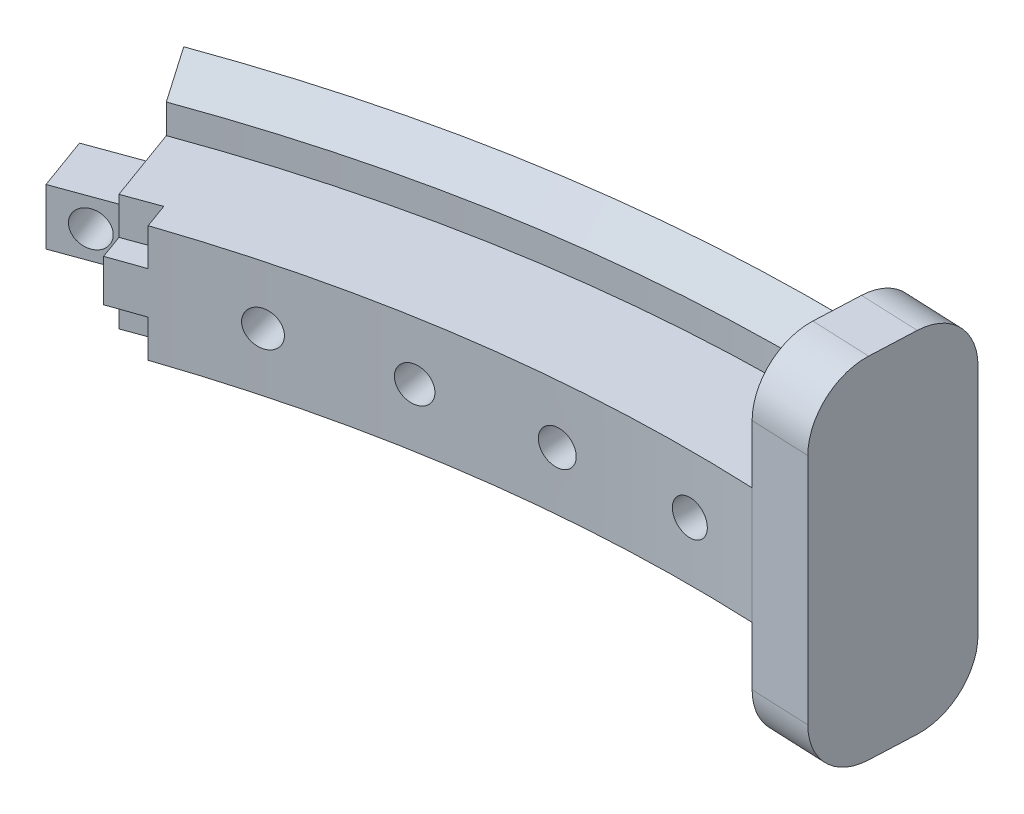
from build123d import *

# Parameters (mm, degrees)
REVOLVE_1_ANGLE          = 40
SKETCH_4_W               = 4.8
SKETCH_4_H               = 4.8
EXTRUDE_1_DEPTH          = 6
SKETCH_7_R               = 1.5
CUT_EXTRUDE_4_DEPTH      = 95.895882206
SKETCH_13_R              = 1.5
CUT_EXTRUDE_7_DEPTH      = 57.80711304
CUT_EXTRUDE_8_DEPTH      = 5
PATTERN_CIRCULAR_1_COUNT = 4
PATTERN_CIRCULAR_1_ANGLE = 15
SKETCH_10_W              = 2.2
SKETCH_10_H              = 5.2
CUT_EXTRUDE_5_DEPTH      = 3
SKETCH_11_W              = 47.375376564
SKETCH_11_H              = 32.407082742
CUT_EXTRUDE_6_DEPTH      = 149.607349927
SKETCH_12_W              = 14
SKETCH_12_H              = 30
EXTRUDE_2_DEPTH          = 5
FILLET_1_R               = 5


# Read off the part's stored shape, not the designer's step: 旋转1
with BuildPart() as part:
    # 旋转1 outline → 旋转1 (revolve)
    with BuildSketch(Plane(origin=(0, 0, 0), x_dir=(0.3420201433256701, 0, -0.9396926207859079), z_dir=(0.9396926207859079, 0, 0.3420201433256701))):
        Polygon((134, 5), (125, 5), (125, -5), (134, -5), (134, -7.5), (136.5, -10), (139, -7.5), (139, 7.5), (136.5, 10), (134, 7.5), align=None)
    revolve(axis=Axis((0, 0, 0), (0, 1, 0)), revolution_arc=REVOLVE_1_ANGLE)

    # 草图4 → 凸台-拉伸1 (add)
    with BuildSketch(Plane(origin=(0, 0, 0), x_dir=(0.3420201433256631, 0, 0.9396926207859104), z_dir=(-0.9396926207859104, 0, 0.3420201433256631))):
        with Locations((-132, 0)):
            Rectangle(SKETCH_4_W, SKETCH_4_H)
    extrude(amount=EXTRUDE_1_DEPTH)

    # 草图7 → 切除-拉伸4 (cut, through all)
    with BuildSketch(Plane(origin=(-45.967507263, 0, -126.294688234), x_dir=(-0.9396926207859105, 0, 0.3420201433256632), z_dir=(-0.3420201433256632, 0, -0.9396926207859105))):
        with Locations((3, 0)):
            Circle(SKETCH_7_R)
    extrude(amount=-CUT_EXTRUDE_4_DEPTH, mode=Mode.SUBTRACT)

    # 草图13 → 切除-拉伸7 (cut, through all)
    with BuildSketch(Plane(origin=(0, 0, -139), x_dir=(-1, 0, 0), z_dir=(0, 0, -1))):
        Circle(SKETCH_13_R)
    cut_extrude_7 = extrude(amount=-CUT_EXTRUDE_7_DEPTH, mode=Mode.SUBTRACT)

    # 草图14 → 切除-拉伸8 (cut)
    with BuildSketch(Plane(origin=(0, 0, -139), x_dir=(-1, 0, 0), z_dir=(0, 0, -1))):
        Polygon((0, -3.175426481), (2.75, -1.58771324), (2.75, 1.58771324), (0, 3.175426481), (-2.75, 1.58771324), (-2.75, -1.58771324), align=None)
    cut_extrude_8 = extrude(amount=-CUT_EXTRUDE_8_DEPTH, mode=Mode.SUBTRACT)

    # 阵列(圆周)1: 切除-拉伸7, 切除-拉伸8 ×4 about axis
    pattern_circular_1_axis = Axis((0, 0, 0), (0, 1, 0))
    add([cut_extrude_7.rotate(pattern_circular_1_axis, i * PATTERN_CIRCULAR_1_ANGLE / (PATTERN_CIRCULAR_1_COUNT - 1)) for i in range(1, PATTERN_CIRCULAR_1_COUNT)], mode=Mode.SUBTRACT)
    add([cut_extrude_8.rotate(pattern_circular_1_axis, i * PATTERN_CIRCULAR_1_ANGLE / (PATTERN_CIRCULAR_1_COUNT - 1)) for i in range(1, PATTERN_CIRCULAR_1_COUNT)], mode=Mode.SUBTRACT)

    # 草图10 → 切除-拉伸5 (cut)
    with BuildSketch(Plane(origin=(0, 0, 0), x_dir=(0.3420201433256631, 0, 0.9396926207859104), z_dir=(-0.9396926207859104, 0, 0.3420201433256631))):
        with Locations((-137.9, 0)):
            Rectangle(SKETCH_10_W, SKETCH_10_H)
        Polygon((-127.2, 5), (-125, 5), (-123.655375964, 5), (-123.655375964, 1.8), (-125, 1.8), (-127.2, 1.8), align=None)
        Polygon((-127.2, -1.8), (-125, -1.8), (-123.655375964, -1.8), (-123.655375964, -5), (-125, -5), (-127.2, -5), align=None)
    extrude(amount=-CUT_EXTRUDE_5_DEPTH, mode=Mode.SUBTRACT)

    # 草图11 → 切除-拉伸6 (cut, through all)
    with BuildSketch(Plane(origin=(0, 0, 0), x_dir=(0, -1, 0), z_dir=(0.9990482215818578, 0, 0.0436193873653361))):
        with Locations((-1.017262687, 125.577370773)):
            Rectangle(SKETCH_11_W, SKETCH_11_H)
    extrude(amount=CUT_EXTRUDE_6_DEPTH, mode=Mode.SUBTRACT)

    # 草图12 → 凸台-拉伸2 (add)
    with BuildSketch(Plane(origin=(0, 0, 0), x_dir=(0.043619387365336125, 0, -0.9990482215818578), z_dir=(0.9990482215818577, 0, 0.04361938736533612))):
        with Locations((132, 0)):
            Rectangle(SKETCH_12_W, SKETCH_12_H)
    extrude(amount=EXTRUDE_2_DEPTH)

    # 圆角1
    fillet_1_edges = [part.edges().sort_by_distance(p)[0] for p in [
        (7.950043975, 15, -124.771979229),
        (7.950043975, -15, -124.771979229),
        (8.560715398, -15, -138.758654331),
        (8.560715398, 15, -138.758654331),
    ]]
    fillet(fillet_1_edges, radius=FILLET_1_R)


solid = part.part
